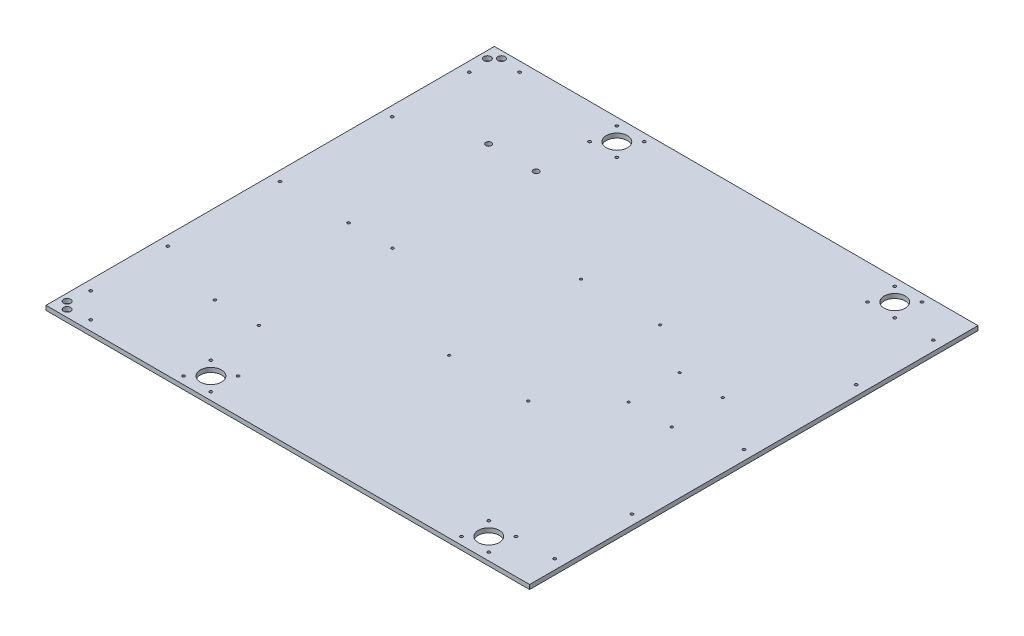
from build123d import *

# Parameters (mm, degrees)
SKETCH1_W                              = 510
SKETCH1_H                              = 5
BOSS_EXTRUDE1_DEPTH                    = 550
BOTTHOMHOLES_SKETCH2_R                 = 12
BOTTHOMHOLES_SKETCH2_R_2               = 1.5875
BOTTOMHOLES_CUT_EXTRUDE1_DEPTH         = 751.083328704
BOTTOMPSUHOLESSKETCH2_R                = 1.5
BOTTOMPSUHOLESSKETCH2_R_2              = 3.25
BOTTOMPSUHOLESCUT_EXTRUDE1_DEPTH       = 751.083328704
BOTTOMMAINBOARDHOLESSKETCH2_R          = 1.35
BOTTOMMAINBOARDHOLESCUT_EXTRUDE1_DEPTH = 751.083328704
CABLEHOLESSKETCH2_R                    = 4
CABLEHOLESCUT_EXTRUDE1_DEPTH           = 751.083328704


with BuildPart() as part:
    # Sketch1 → Boss-Extrude1 (new body)
    with BuildSketch(Plane(origin=(0, 0, 0), x_dir=(0, 0, -1), z_dir=(1, 0, 0))):
        with Locations((-255, 2.5)):
            Rectangle(SKETCH1_W, SKETCH1_H)
    extrude(amount=BOSS_EXTRUDE1_DEPTH)

    # BotthomHoles-Sketch2 → BottomHoles-Cut-Extrude1 (cut, through all)
    with BuildSketch(Plane(origin=(0, 5, 0), x_dir=(1, 0, 0), z_dir=(0, 1, 0))):
        with Locations((479.425, -24.175)):
            Circle(BOTTHOMHOLES_SKETCH2_R)
        with Locations((463.925, -8.675)):
            Circle(BOTTHOMHOLES_SKETCH2_R_2)
        with Locations((494.925, -8.675)):
            Circle(BOTTHOMHOLES_SKETCH2_R_2)
        with Locations((463.925, -39.675)):
            Circle(BOTTHOMHOLES_SKETCH2_R_2)
        with Locations((494.925, -39.675)):
            Circle(BOTTHOMHOLES_SKETCH2_R_2)
        with Locations((39.6875, -11.1125)):
            Circle(BOTTHOMHOLES_SKETCH2_R_2)
        with Locations((178.925, -39.675)):
            Circle(BOTTHOMHOLES_SKETCH2_R_2)
        with Locations((147.925, -39.675)):
            Circle(BOTTHOMHOLES_SKETCH2_R_2)
        with Locations((178.925, -8.675)):
            Circle(BOTTHOMHOLES_SKETCH2_R_2)
        with Locations((147.925, -8.675)):
            Circle(BOTTHOMHOLES_SKETCH2_R_2)
        with Locations((163.425, -24.175)):
            Circle(BOTTHOMHOLES_SKETCH2_R)
        with Locations((39.6875, -498.8875)):
            Circle(BOTTHOMHOLES_SKETCH2_R_2)
        with Locations((147.925, -501.325)):
            Circle(BOTTHOMHOLES_SKETCH2_R_2)
        with Locations((178.925, -501.325)):
            Circle(BOTTHOMHOLES_SKETCH2_R_2)
        with Locations((147.925, -470.325)):
            Circle(BOTTHOMHOLES_SKETCH2_R_2)
        with Locations((178.925, -470.325)):
            Circle(BOTTHOMHOLES_SKETCH2_R_2)
        with Locations((463.925, -470.325)):
            Circle(BOTTHOMHOLES_SKETCH2_R_2)
        with Locations((463.925, -501.325)):
            Circle(BOTTHOMHOLES_SKETCH2_R_2)
        with Locations((494.925, -470.325)):
            Circle(BOTTHOMHOLES_SKETCH2_R_2)
        with Locations((494.925, -501.325)):
            Circle(BOTTHOMHOLES_SKETCH2_R_2)
        with Locations((163.425, -485.825)):
            Circle(BOTTHOMHOLES_SKETCH2_R)
        with Locations((479.425, -485.825)):
            Circle(BOTTHOMHOLES_SKETCH2_R)
        with Locations((11.1125, -39.6875)):
            Circle(BOTTHOMHOLES_SKETCH2_R_2)
        with Locations((11.1125, -127.5)):
            Circle(BOTTHOMHOLES_SKETCH2_R_2)
        with Locations((11.1125, -255)):
            Circle(BOTTHOMHOLES_SKETCH2_R_2)
        with Locations((11.1125, -382.5)):
            Circle(BOTTHOMHOLES_SKETCH2_R_2)
        with Locations((11.1125, -470.3125)):
            Circle(BOTTHOMHOLES_SKETCH2_R_2)
        with Locations((538.8875, -470.3125)):
            Circle(BOTTHOMHOLES_SKETCH2_R_2)
        with Locations((538.8875, -382.5)):
            Circle(BOTTHOMHOLES_SKETCH2_R_2)
        with Locations((538.8875, -255)):
            Circle(BOTTHOMHOLES_SKETCH2_R_2)
        with Locations((538.8875, -127.5)):
            Circle(BOTTHOMHOLES_SKETCH2_R_2)
        with Locations((538.8875, -39.6875)):
            Circle(BOTTHOMHOLES_SKETCH2_R_2)
    extrude(amount=-BOTTOMHOLES_CUT_EXTRUDE1_DEPTH, mode=Mode.SUBTRACT)

    # BottomPSUHolesSketch2 → BottomPSUHolesCut-Extrude1 (cut, through all)
    with BuildSketch(Plane(origin=(0, 5, 0), x_dir=(1, 0, 0), z_dir=(0, 1, 0))):
        with Locations((90.8, -256.7)):
            Circle(BOTTOMPSUHOLESSKETCH2_R)
        with Locations((140.8, -256.7)):
            Circle(BOTTOMPSUHOLESSKETCH2_R)
        with Locations((90.8, -408.7)):
            Circle(BOTTOMPSUHOLESSKETCH2_R)
        with Locations((140.8, -408.7)):
            Circle(BOTTOMPSUHOLESSKETCH2_R)
        with Locations((92.8, -99.3)):
            Circle(BOTTOMPSUHOLESSKETCH2_R_2)
        with Locations((146.8, -99.3)):
            Circle(BOTTOMPSUHOLESSKETCH2_R_2)
    extrude(amount=-BOTTOMPSUHOLESCUT_EXTRUDE1_DEPTH, mode=Mode.SUBTRACT)

    # BottomMainboardHolesSketch2 → BottomMainboardHolesCut-Extrude1 (cut, through all)
    with BuildSketch(Plane(origin=(0, 5, 0), x_dir=(1, 0, 0), z_dir=(0, 1, 0))):
        with Locations((278.5, -180)):
            Circle(BOTTOMMAINBOARDHOLESSKETCH2_R)
        with Locations((368.5, -180)):
            Circle(BOTTOMMAINBOARDHOLESSKETCH2_R)
        with Locations((278.5, -330)):
            Circle(BOTTOMMAINBOARDHOLESSKETCH2_R)
        with Locations((368.5, -330)):
            Circle(BOTTOMMAINBOARDHOLESSKETCH2_R)
        with Locations((426.7, -216)):
            Circle(BOTTOMMAINBOARDHOLESSKETCH2_R)
        with Locations((475.7, -216)):
            Circle(BOTTOMMAINBOARDHOLESSKETCH2_R)
        with Locations((426.7, -274)):
            Circle(BOTTOMMAINBOARDHOLESSKETCH2_R)
        with Locations((475.7, -274)):
            Circle(BOTTOMMAINBOARDHOLESSKETCH2_R)
    extrude(amount=-BOTTOMMAINBOARDHOLESCUT_EXTRUDE1_DEPTH, mode=Mode.SUBTRACT)

    # CableHolesSketch2 → CableHolesCut-Extrude1 (cut, through all)
    with BuildSketch(Plane(origin=(0, 5, 0), x_dir=(1, 0, 0), z_dir=(0, 1, 0))):
        with Locations((8, -494)):
            Circle(CABLEHOLESSKETCH2_R)
        with Locations((16, -502)):
            Circle(CABLEHOLESSKETCH2_R)
        with Locations((8, -16)):
            Circle(CABLEHOLESSKETCH2_R)
        with Locations((16, -8)):
            Circle(CABLEHOLESSKETCH2_R)
    extrude(amount=-CABLEHOLESCUT_EXTRUDE1_DEPTH, mode=Mode.SUBTRACT)


solid = part.part
